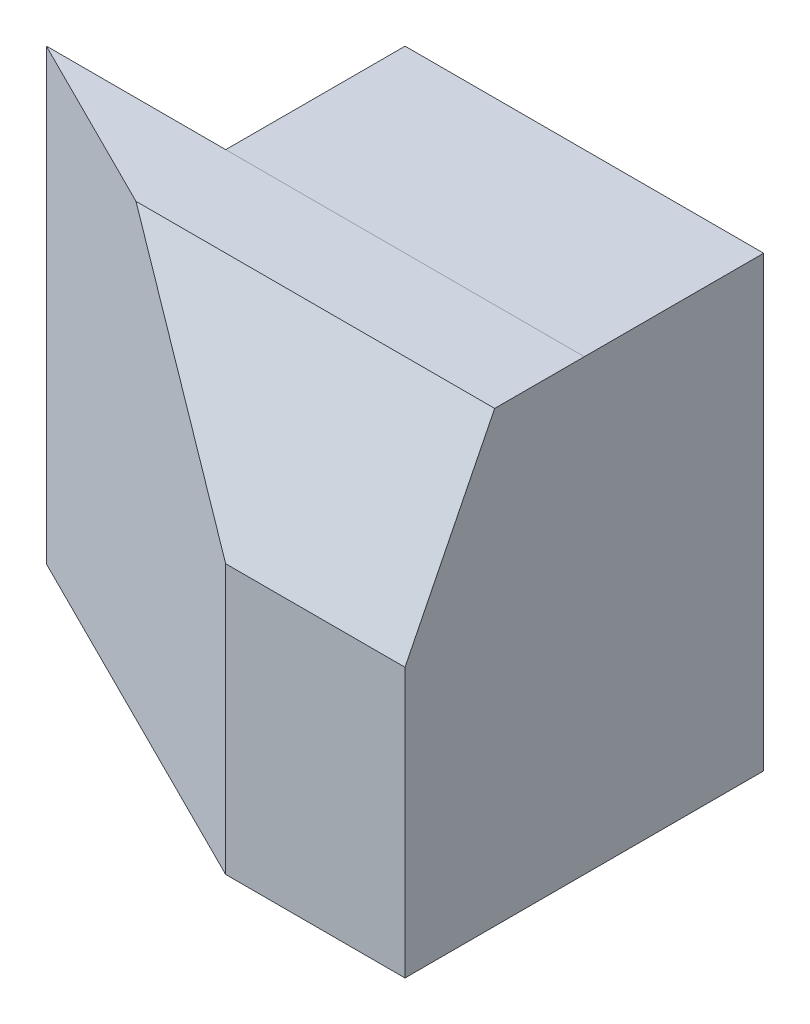
from build123d import *

# Parameters (mm, degrees)
BOSS_EXTRUDE1_DEPTH = 2
SKETCH2_W           = 6
SKETCH2_H           = 5.001068762
BOSS_EXTRUDE2_DEPTH = 2
CHAMFER1_SIZE       = 1
CHAMFER1_SIZE2      = 2
CUT_EXTRUDE2_DEPTH  = 2
CUT_EXTRUDE3_DEPTH  = 2


with BuildPart() as part:
    # Sketch1 → Boss-Extrude1 (new body)
    with BuildSketch(Plane.XY):
        Polygon((0, 0), (6, 0), (6, 5), (2, 5), (0, 5), (0, 3), align=None)
    extrude(amount=BOSS_EXTRUDE1_DEPTH)

    # Sketch2 → Boss-Extrude2 (add)
    with BuildSketch(Plane.XY.offset(2)):
        with Locations((3, 2.500534381)):
            Rectangle(SKETCH2_W, SKETCH2_H)
    extrude(amount=BOSS_EXTRUDE2_DEPTH)

    # Chamfer1
    chamfer1_edges = [part.edges().sort_by_distance(p)[0] for p in [
        (3, 5.001068762, 4),
    ]]
    chamfer1_side = [part.faces().sort_by_distance(p)[0] for p in [
        (3, 5.001068762, 3),
    ]]
    chamfer(chamfer1_edges, length=CHAMFER1_SIZE, length2=CHAMFER1_SIZE2, reference=chamfer1_side[0])

    # 3DSketch1 → Cut-Extrude2 (cut, along a direction that is not the sketch's normal)
    with BuildSketch(Plane(origin=(2, 5.001068762, 3), x_dir=(0.36508333931807946, -0.9129034418767683, 0.18254166965903973), z_dir=(0.447213595499958, 0, -0.894427190999916))):
        Polygon((0, 0), (2.738515232, -1.224962989), (5.478201234, 0), (3.652784538, 4.082628306), (-0.912708348, 2.041314153), align=None)
    extrude(amount=-CUT_EXTRUDE2_DEPTH, dir=(0, 0, -1), mode=Mode.SUBTRACT)

    # Sketch4 → Cut-Extrude3 (cut)
    with BuildSketch(Plane(origin=(0, 0, 0), x_dir=(-1, 0, 0), z_dir=(0, 0, -1))):
        Polygon((0, 5.000534381), (-2, 5.001068762), (-4, 3.001068762), (-4, 0), (0, 0), align=None)
    extrude(amount=-CUT_EXTRUDE3_DEPTH, mode=Mode.SUBTRACT)


solid = part.part
